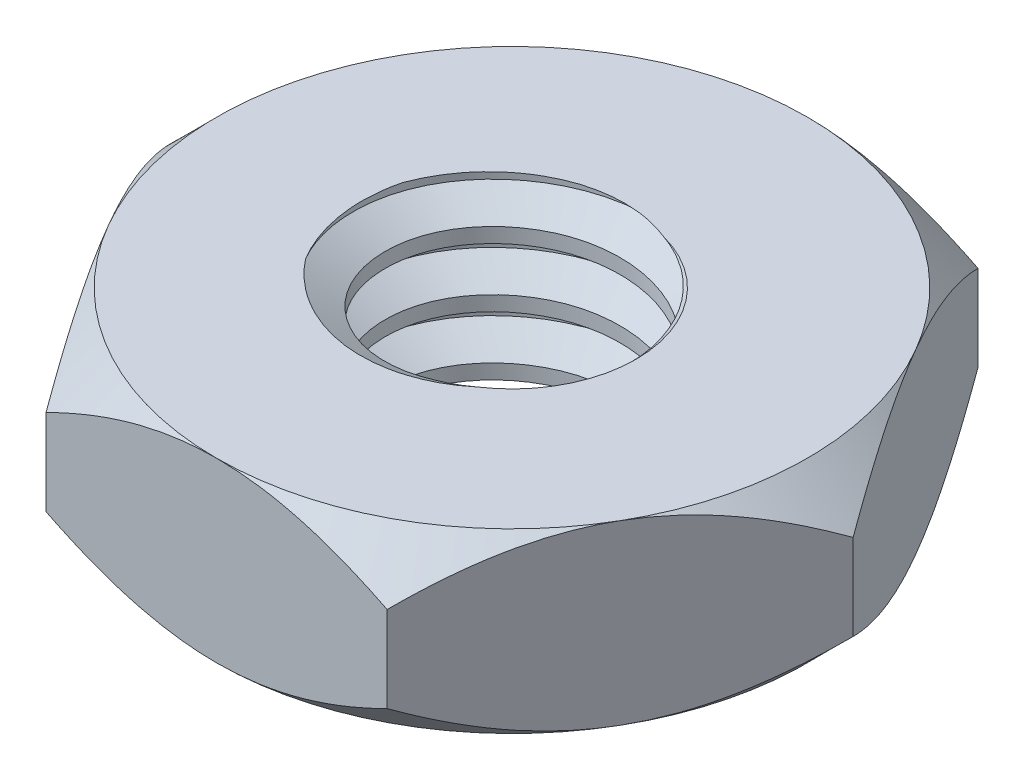
from build123d import *

# Parameters (mm, degrees)
BOSS_EXTRUDE1_DEPTH     = 0.75
SKETCH2_OUTSIDE_W       = 19.536
SKETCH2_OUTSIDE_H       = 18.762
SKETCH2_OUTSIDE_R       = 2.5
CUT_EXTRUDE1_DEPTH      = 5.102844542
CUT_EXTRUDE1_DRAFT      = -45
MIRROR1_COPY_1_SKETCH_W = 19.536
MIRROR1_COPY_1_SKETCH_H = 18.762
MIRROR1_COPY_1_SKETCH_R = 2.5
MIRROR1_COPY_1_DEPTH    = 5.102844542
MIRROR1_COPY_1_DRAFT    = -45
SKETCH3_R               = 1
CUT_EXTRUDE2_DEPTH      = 5.102844542
CHAMFER1_SIZE           = 0.05
THREAD1_PITCH           = 0.5


with BuildPart() as part:
    # Sketch1 → Boss-Extrude1 (new, symmetric)
    with BuildSketch(Plane(origin=(0, 0, 0), x_dir=(1, 0, 0), z_dir=(0, 1, 0))):
        Polygon((2.886751346, 0), (1.443375673, 2.5), (-1.443375673, 2.5), (-2.886751346, 0), (-1.443375673, -2.5), (1.443375673, -2.5), align=None)
    extrude(amount=BOSS_EXTRUDE1_DEPTH, both=True)


with BuildPart() as cut_extrude1_tool:
    # Sketch2 outside → Cut-Extrude1 (with draft: the straight prism first)
    with BuildSketch(Plane(origin=(0, 0.75, 0), x_dir=(1, 0, 0), z_dir=(0, 1, 0))):
        Rectangle(SKETCH2_OUTSIDE_W, SKETCH2_OUTSIDE_H)
        Circle(SKETCH2_OUTSIDE_R, mode=Mode.SUBTRACT)
    extrude(amount=-CUT_EXTRUDE1_DEPTH)
    # Cut-Extrude1: the draft: its side faces are tilted about the plane it starts from
    cut_extrude1_sides = [cut_extrude1_tool.faces().sort_by_distance(p)[0] for p in [
        (0, -1.801422271, 9.381),
        (9.768, -1.801422271, 0),
        (0, -1.801422271, -9.381),
        (-9.768, -1.801422271, 0),
        (-2.5, -1.801422271, 0),
    ]]
    draft(cut_extrude1_sides, Plane(origin=(0, 0.75, 0), x_dir=(1, 0, 0), z_dir=(0, 1, 0)), CUT_EXTRUDE1_DRAFT)


with BuildPart() as part_1:
    add(part.part)

    # Cut-Extrude1: cut by cut_extrude1_tool
    add(cut_extrude1_tool.part, mode=Mode.SUBTRACT)


with BuildPart() as mirror1_copy_1_tool:
    # Mirror1 copy 1 sketch → Mirror1 copy 1 (with draft: the straight prism first)
    with BuildSketch(Plane.XZ.offset(0.75)):
        Rectangle(MIRROR1_COPY_1_SKETCH_W, MIRROR1_COPY_1_SKETCH_H)
        Circle(MIRROR1_COPY_1_SKETCH_R, mode=Mode.SUBTRACT)
    extrude(amount=-MIRROR1_COPY_1_DEPTH)
    # Mirror1 copy 1: the draft: its side faces are tilted about the plane it starts from
    mirror1_copy_1_sides = [mirror1_copy_1_tool.faces().sort_by_distance(p)[0] for p in [
        (0, 1.801422271, 9.381),
        (9.768, 1.801422271, 0),
        (0, 1.801422271, -9.381),
        (-9.768, 1.801422271, 0),
        (-2.5, 1.801422271, 0),
    ]]
    draft(mirror1_copy_1_sides, Plane.XZ.offset(0.75), MIRROR1_COPY_1_DRAFT)


with BuildPart() as part_2:
    add(part_1.part)

    # Mirror1 copy 1: cut by mirror1_copy_1_tool
    add(mirror1_copy_1_tool.part, mode=Mode.SUBTRACT)

    # Sketch3 → Cut-Extrude2 (cut, through all)
    with BuildSketch(Plane(origin=(0, 0.75, 0), x_dir=(1, 0, 0), z_dir=(0, 1, 0))):
        with Locations(Location((0, 0, 0), (0, 0, 270))):
            Circle(SKETCH3_R)
    extrude(amount=-CUT_EXTRUDE2_DEPTH, mode=Mode.SUBTRACT)

    # Chamfer1
    chamfer1_edges = [part_2.edges().sort_by_distance(p)[0] for p in [
        (0, -0.75, -1),
        (0, 0.75, -1),
    ]]
    chamfer(chamfer1_edges, length=CHAMFER1_SIZE)

    # Thread1: the profile of Thread Profile1 profile screwed along a right-hand helix of 4.9 turns, 6 arcs to a turn; built about Z, then put on its axis
    thread1_z = Axis((0, 0, 0), (0, 0, 1))
    thread1_corners = [(0.9997, 0, -0.000173205), (1.270632938, 0, 0.156249999), (1.270632937, 0, 0.218749999), (0.9997, 0, 0.375173204)]
    with BuildLine(mode=Mode.PRIVATE) as thread1_profile:
        Line(thread1_corners[0], thread1_corners[1])
        Line(thread1_corners[1], thread1_corners[2])
        Line(thread1_corners[2], thread1_corners[3])
        Line(thread1_corners[3], thread1_corners[0])
    thread1_cap = Face(thread1_profile.wire())
    thread1_turn_angles = [0, 30, 60, 90, 120, 150, 180, 210, 240, 270, 300, 330, 360]
    thread1_turn_weights = [1, 0.8660254037844387, 1, 0.8660254037844387, 1, 0.8660254037844387, 1, 0.8660254037844387, 1, 0.8660254037844387, 1, 0.8660254037844387, 1]
    thread1_turn_rails = [Edge.make_bspline([Vector(p[0], p[1], 0).rotate(thread1_z, thread1_turn_angles[k]) / thread1_turn_weights[k] + Vector(0, 0, p[2] + THREAD1_PITCH * thread1_turn_angles[k] / 360) for k in range(13)], [0, 0, 0, 1, 1, 2, 2, 3, 3, 4, 4, 5, 5, 6, 6, 6], 2, thread1_turn_weights) for p in thread1_corners]
    thread1_turn_sides = [Face.make_surface_from_curves(thread1_turn_rails[p[0]], thread1_turn_rails[p[1]]) for p in [(0, 1), (1, 2), (2, 3), (3, 0)]]
    thread1_last_angles = [1440, 1470, 1500, 1530, 1560, 1590, 1620, 1650, 1680, 1710, 1740, 1752, 1764]
    thread1_last_weights = [1, 0.8660254037844387, 1, 0.8660254037844387, 1, 0.8660254037844387, 1, 0.8660254037844387, 1, 0.8660254037844387, 1, 0.9781476007337974, 1]
    thread1_last_rails = [Edge.make_bspline([Vector(p[0], p[1], 0).rotate(thread1_z, thread1_last_angles[k]) / thread1_last_weights[k] + Vector(0, 0, p[2] + THREAD1_PITCH * thread1_last_angles[k] / 360) for k in range(13)], [0, 0, 0, 1, 1, 2, 2, 3, 3, 4, 4, 5, 5, 6, 6, 6], 2, thread1_last_weights) for p in thread1_corners]
    thread1_last_sides = [Face.make_surface_from_curves(thread1_last_rails[p[0]], thread1_last_rails[p[1]]) for p in [(0, 1), (1, 2), (2, 3), (3, 0)]]
    thread1 = Plane(origin=(0, -1.7, 0), x_dir=(1, 0, 0), z_dir=(0, 1, 0)) * Solid(Shell([*[p.moved(Location((0, 0, THREAD1_PITCH * i))) for i in range(4) for p in thread1_turn_sides], *thread1_last_sides, thread1_cap, thread1_cap.rotate(thread1_z, 1764).moved(Location((0, 0, THREAD1_PITCH * 1764 / 360)))]))
    add(thread1, mode=Mode.SUBTRACT)


solid = part_2.part
